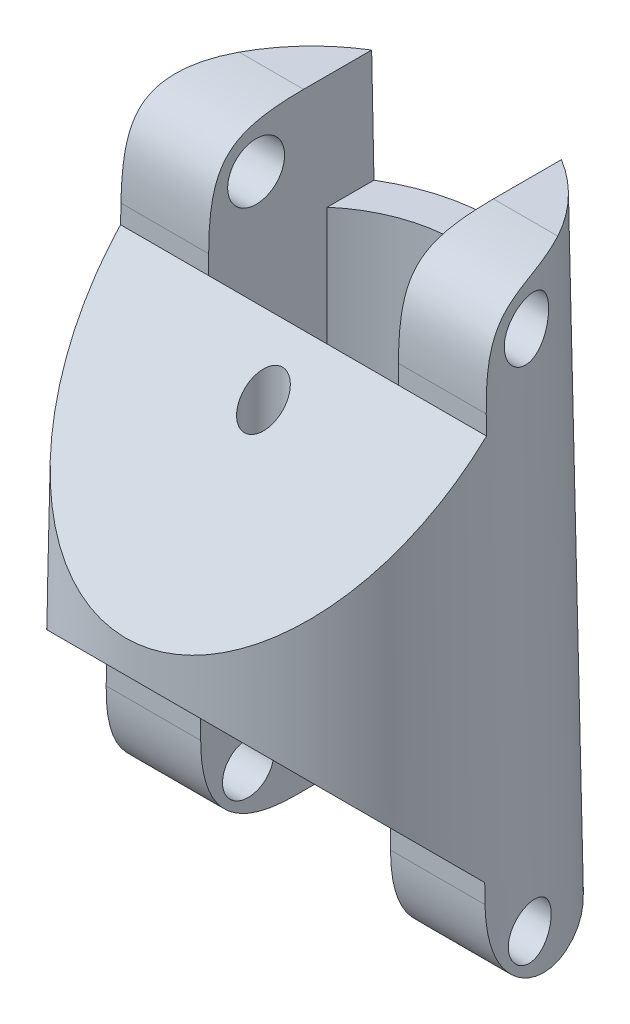
from build123d import *

# Parameters (mm, degrees)
SKETCH1_R                     = 10
BOSS_EXTRUDE1_DEPTH           = 26
BOSS_EXTRUDE1_TAPER           = 1
BOSS_EXTRUDE1_OTHER_WAY_DEPTH = 6
BOSS_EXTRUDE1_OTHER_WAY_TAPER = -1
CUT_EXTRUDE1_DEPTH            = 30.668352709
CUT_EXTRUDE1_DEPTH_BACK       = 30.668352709
SKETCH3_W                     = 10
SKETCH3_H                     = 6
CUT_EXTRUDE2_DEPTH            = 25
CUT_EXTRUDE3_DEPTH            = 32.721577304
CUT_EXTRUDE3_DEPTH_BACK       = 32.721577304
SKETCH4_R                     = 1.5
FILLET2_SIZE                  = 5
CUT_EXTRUDE5_DEPTH            = 30.668352865
CUT_EXTRUDE5_DEPTH_BACK       = 30.668352865
SKETCH8_W                     = 10
SKETCH8_H                     = 6
CUT_EXTRUDE6_DEPTH            = 30.976934008
CUT_EXTRUDE7_DEPTH            = 30.632846395
CUT_EXTRUDE8_DEPTH            = 32.688371532
CUT_EXTRUDE8_DEPTH_BACK       = 32.688371532
SKETCH9_R                     = 1.351518808
FILLET3_SIZE                  = 5
SKETCH10_R                    = 1
CUT_EXTRUDE9_DEPTH            = 30.623606957


with BuildPart() as part:
    # Sketch1 → Boss-Extrude1 (new body)
    with BuildSketch(Plane(origin=(0, 0, 0), x_dir=(1, 0, 0), z_dir=(0, 1, 0))):
        Circle(SKETCH1_R)
    extrude(amount=BOSS_EXTRUDE1_DEPTH, taper=BOSS_EXTRUDE1_TAPER)

    # Sketch1 → Boss-Extrude1 other way (add)
    with BuildSketch(Plane(origin=(0, 0, 0), x_dir=(1, 0, 0), z_dir=(0, 1, 0))):
        Circle(SKETCH1_R)
    extrude(amount=-BOSS_EXTRUDE1_OTHER_WAY_DEPTH, taper=BOSS_EXTRUDE1_OTHER_WAY_TAPER)

    # Sketch2 → Cut-Extrude1 (cut, two sides: drawn at the far end of the back side and taken through both)
    with BuildSketch(Plane(origin=(0, 0, 0), x_dir=(0, 0, -1), z_dir=(1, 0, 0)).offset(-CUT_EXTRUDE1_DEPTH_BACK)):
        Polygon((-0.453831688, 26), (-0.453831688, 20), (-13.188542788, 7.2652889), (-13.188542788, 26), align=None)
    extrude(amount=CUT_EXTRUDE1_DEPTH + CUT_EXTRUDE1_DEPTH_BACK, mode=Mode.SUBTRACT)

    # Sketch3 → Cut-Extrude2 (cut)
    with BuildSketch(Plane.XY.offset(0.453831688)):
        with Locations((0, 23)):
            Rectangle(SKETCH3_W, SKETCH3_H)
    extrude(amount=-CUT_EXTRUDE2_DEPTH, mode=Mode.SUBTRACT)

    # Sketch4 → Cut-Extrude3 (cut, two sides: drawn at the far end of the back side and taken through both)
    with BuildSketch(Plane(origin=(-5, 0, 0), x_dir=(0, 0, -1), z_dir=(1, 0, 0)).offset(-CUT_EXTRUDE3_DEPTH_BACK)):
        with Locations((2.046168312, 23.5)):
            Circle(SKETCH4_R)
    extrude(amount=CUT_EXTRUDE3_DEPTH + CUT_EXTRUDE3_DEPTH_BACK, mode=Mode.SUBTRACT)

    # Fillet2
    # a fillet whose section is not a circle: 5 mm, written as the material it takes off along each edge
    with BuildSketch(Plane(origin=(-7.5, 26, 0.453831688), x_dir=(0, -1, 0), z_dir=(1, 0, 0))) as fillet2_piece_1:
        with BuildLine():
            Bezier((FILLET2_SIZE, 0), (0, 0), (0, FILLET2_SIZE), weights=[1, 1.5, 1])
            Line((0, FILLET2_SIZE), (0, 0))
            Line((0, 0), (FILLET2_SIZE, 0))
        make_face()
    extrude(amount=29.535374468, mode=Mode.SUBTRACT)
    with BuildSketch(Plane(origin=(-22.035374468, 26, 0.453831688), x_dir=(0, 0, -1), z_dir=(1, 0, 0))) as fillet2_piece_2:
        with BuildLine():
            Bezier((FILLET2_SIZE, 0), (0, 0), (0, -FILLET2_SIZE), weights=[1, 1.5, 1])
            Line((0, -FILLET2_SIZE), (0, 0))
            Line((0, 0), (FILLET2_SIZE, 0))
        make_face()
    extrude(amount=29.535374468, mode=Mode.SUBTRACT)

    # Sketch7 → Cut-Extrude5 (cut, two sides: drawn at the far end of the back side and taken through both)
    with BuildSketch(Plane(origin=(0, 0, 0), x_dir=(0, 0, -1), z_dir=(1, 0, 0)).offset(-CUT_EXTRUDE5_DEPTH_BACK)):
        Polygon((-0.873019237, -6), (-0.873019237, 0), (-11.31781305, 10.444793812), (-11.31781305, -6), align=None)
    extrude(amount=CUT_EXTRUDE5_DEPTH + CUT_EXTRUDE5_DEPTH_BACK, mode=Mode.SUBTRACT)

    # Sketch8 → Cut-Extrude6 (cut, through all)
    with BuildSketch(Plane.XY.offset(0.873019237)):
        with Locations((0, -3)):
            Rectangle(SKETCH8_W, SKETCH8_H)
    extrude(amount=-CUT_EXTRUDE6_DEPTH, mode=Mode.SUBTRACT)

    # Sketch6 → Cut-Extrude7 (cut, through all)
    with BuildSketch(Plane(origin=(0, 20, 0), x_dir=(1, 0, 0), z_dir=(0, 1, 0))):
        with BuildLine():
            Line((5, 5.791049209), (5, -0.453831688))
            Line((5, -0.453831688), (-5, -0.453831688))
            Line((-5, -0.453831688), (-5, 5.791049209))
            ThreePointArc((-5, 5.791049209), (0, 7.650898701), (5, 5.791049209))
        make_face()
    extrude(amount=-CUT_EXTRUDE7_DEPTH, mode=Mode.SUBTRACT)

    # Sketch9 → Cut-Extrude8 (cut, two sides: drawn at the far end of the back side and taken through both)
    with BuildSketch(Plane(origin=(-5, 0, 0), x_dir=(0, 0, -1), z_dir=(1, 0, 0)).offset(-CUT_EXTRUDE8_DEPTH_BACK)):
        with Locations((1.626980763, -3.5)):
            Circle(SKETCH9_R)
    extrude(amount=CUT_EXTRUDE8_DEPTH + CUT_EXTRUDE8_DEPTH_BACK, mode=Mode.SUBTRACT)

    # Fillet3
    # a fillet whose section is not a circle: 5 mm, written as the material it takes off along each edge
    with BuildSketch(Plane(origin=(22.566946591, -6, 0.873019237), x_dir=(0, 0, -1), z_dir=(-1, 0, 0))) as fillet3_piece_1:
        with BuildLine():
            Bezier((FILLET3_SIZE, 0), (0, 0), (0, -FILLET3_SIZE), weights=[1, 1, 1])
            Line((0, -FILLET3_SIZE), (0, 0))
            Line((0, 0), (FILLET3_SIZE, 0))
        make_face()
    extrude(amount=30.066946591, mode=Mode.SUBTRACT)
    with BuildSketch(Plane(origin=(7.5, -6, 0.873019237), x_dir=(0, 1, 0), z_dir=(-1, 0, 0))) as fillet3_piece_2:
        with BuildLine():
            Bezier((FILLET3_SIZE, 0), (0, 0), (0, FILLET3_SIZE), weights=[1, 1, 1])
            Line((0, FILLET3_SIZE), (0, 0))
            Line((0, 0), (FILLET3_SIZE, 0))
        make_face()
    extrude(amount=30.066946591, mode=Mode.SUBTRACT)

    # Sketch10 → Cut-Extrude9 (cut, through all)
    with BuildSketch(Plane(origin=(0, 20, 0), x_dir=(1, 0, 0), z_dir=(0, 1, 0))):
        with Locations(Location((0, -2.56777392, 0), (0, 0, 270))):
            Circle(SKETCH10_R)
    extrude(amount=-CUT_EXTRUDE9_DEPTH, mode=Mode.SUBTRACT)


solid = part.part
